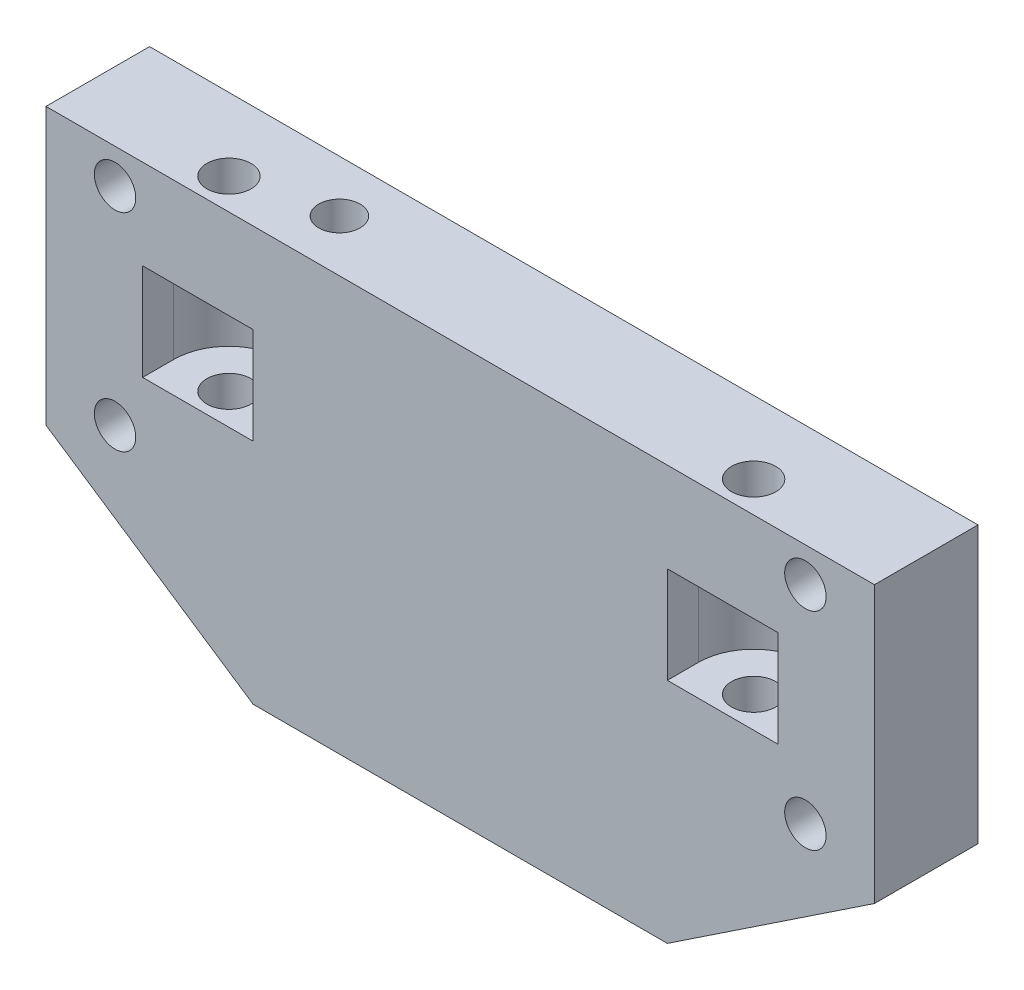
from build123d import *

# Parameters (mm, degrees)
BOSS_EXTRUDE1_DEPTH     = 9.525
SKETCH2_R               = 1.905
CUT_EXTRUDE1_DEPTH      = 81.884643938
CUT_EXTRUDE2_DEPTH      = 4.445
SKETCH5_R               = 2.032
CUT_EXTRUDE3_DEPTH      = 28.575
MIRROR2_COPY_1_SKETCH_R = 1.905
MIRROR2_COPY_1_DEPTH    = 81.884643938
SKETCH12_R              = 1.905
CUT_EXTRUDE7_DEPTH      = 9.525
SKETCH13_R              = 1.905
CUT_EXTRUDE8_DEPTH      = 6.35


with BuildPart() as part:
    # Sketch1 → Boss-Extrude1 (new body)
    with BuildSketch(Plane.XY):
        Polygon((0, 0), (19.05, -12.7), (57.15, -12.7), (76.2, 0), (76.2, 25.4), (0, 25.4), align=None)
    extrude(amount=BOSS_EXTRUDE1_DEPTH)

    # Sketch2 → Cut-Extrude1 (cut, through all)
    with BuildSketch(Plane.XY.offset(9.525)):
        with Locations((6.35, 22.225)):
            Circle(SKETCH2_R)
    cut_extrude1 = extrude(amount=-CUT_EXTRUDE1_DEPTH, mode=Mode.SUBTRACT)

    # Sketch4 → Cut-Extrude2 (cut, symmetric)
    with BuildSketch(Plane(origin=(0, 12.7, 0), x_dir=(1, 0, 0), z_dir=(0, 1, 0))):
        with BuildLine():
            Line((8.89, -6.6675), (8.89, -9.525))
            Line((8.89, -9.525), (19.05, -9.525))
            Line((19.05, -9.525), (19.05, -6.6675))
            ThreePointArc((19.05, -6.6675), (13.97, -1.5875), (8.89, -6.6675))
        make_face()
    cut_extrude2 = extrude(amount=CUT_EXTRUDE2_DEPTH, both=True, mode=Mode.SUBTRACT)

    # Sketch5 → Cut-Extrude3 (cut)
    with BuildSketch(Plane(origin=(0, 25.4, 0), x_dir=(1, 0, 0), z_dir=(0, 1, 0))):
        with Locations((13.97, -6.6675)):
            Circle(SKETCH5_R)
    cut_extrude3 = extrude(amount=-CUT_EXTRUDE3_DEPTH, mode=Mode.SUBTRACT)

    # Mirror1: Cut-Extrude1 across plane
    add(cut_extrude1.mirror(Plane.ZX.offset(12.7)), mode=Mode.SUBTRACT)

    # Mirror2: Cut-Extrude1, Cut-Extrude2, Cut-Extrude3 across plane
    add(cut_extrude1.mirror(Plane(origin=(38.1, 0, 0), x_dir=(0, 0, 1), z_dir=(1, 0, 0))), mode=Mode.SUBTRACT)
    add(cut_extrude2.mirror(Plane(origin=(38.1, 0, 0), x_dir=(0, 0, 1), z_dir=(1, 0, 0))), mode=Mode.SUBTRACT)
    add(cut_extrude3.mirror(Plane(origin=(38.1, 0, 0), x_dir=(0, 0, 1), z_dir=(1, 0, 0))), mode=Mode.SUBTRACT)

    # Mirror2 copy 1 sketch → Mirror2 copy 1 (cut, through all)
    with BuildSketch(Plane(origin=(76.2, 25.4, 9.525), x_dir=(-1, 0, 0), z_dir=(0, 0, 1))):
        with Locations((6.35, 22.225)):
            Circle(MIRROR2_COPY_1_SKETCH_R)
    extrude(amount=-MIRROR2_COPY_1_DEPTH, mode=Mode.SUBTRACT)

    # Sketch12 → Cut-Extrude7 (cut)
    with BuildSketch(Plane(origin=(0, 25.4, 0), x_dir=(1, 0, 0), z_dir=(0, 1, 0))):
        with Locations((22.225, -4.7625)):
            Circle(SKETCH12_R)
    extrude(amount=-CUT_EXTRUDE7_DEPTH, mode=Mode.SUBTRACT)

    # Sketch13 → Cut-Extrude8 (cut)
    with BuildSketch(Plane.ZY):
        with Locations((4.7625, 12.7)):
            Circle(SKETCH13_R)
    extrude(amount=-CUT_EXTRUDE8_DEPTH, mode=Mode.SUBTRACT)


solid = part.part
